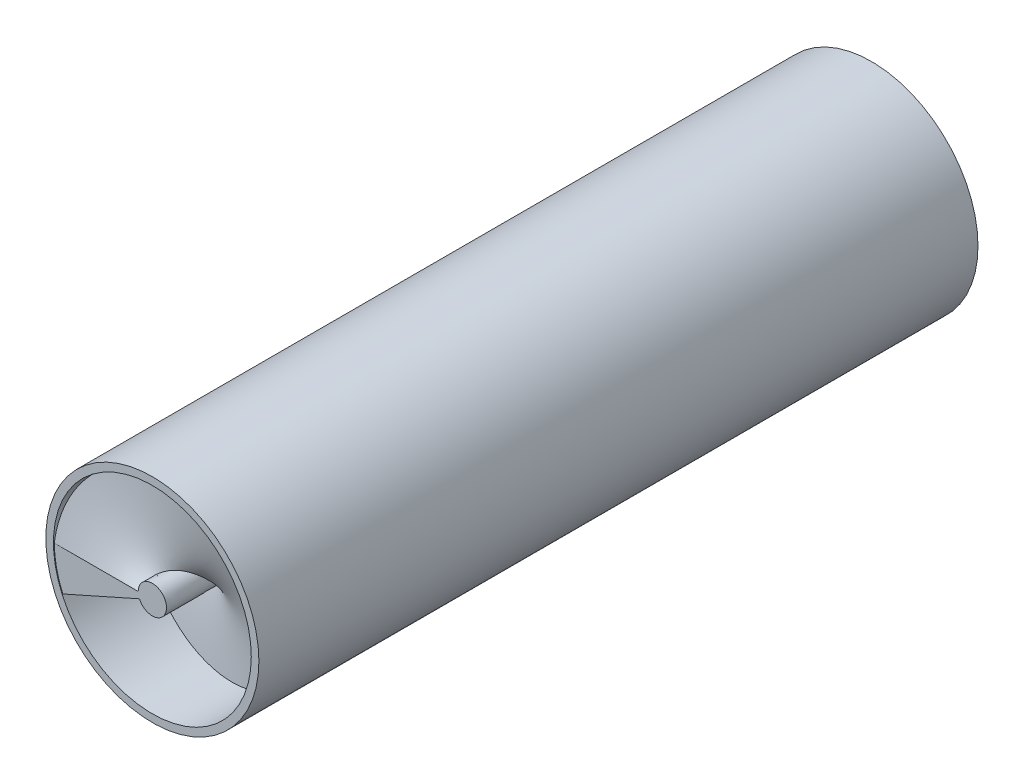
from build123d import *

# Parameters (mm, degrees)
SKETCH2_R           = 44.45
SKETCH2_R_2         = 41.275
BOSS_EXTRUDE2_DEPTH = 300
SKETCH3_R           = 40.9
BOSS_EXTRUDE3_DEPTH = 300
CUT_SWEEP2_PITCH    = 37.5


with BuildPart() as part:
    # Sketch2 → Boss-Extrude2 (new body)
    with BuildSketch(Plane.XY):
        Circle(SKETCH2_R)
        Circle(SKETCH2_R_2, mode=Mode.SUBTRACT)
    extrude(amount=BOSS_EXTRUDE2_DEPTH)


with BuildPart() as body_2:
    # Sketch3 → Boss-Extrude3 (new body)
    with BuildSketch(Plane.XY):
        Circle(SKETCH3_R)
    extrude(amount=BOSS_EXTRUDE3_DEPTH)

    # Cut-Sweep2: arcs per turn and ends read off the stored shape
    # Cut-Sweep2: the profile of Sketch8 profile screwed along a right-hand helix through 9.5 turns, 24 arcs to a turn; built about Z, then put on its axis
    cut_sweep2_z = Axis((0, 0, 0), (0, 0, 1))
    cut_sweep2_corners = [(40.9003, 0, -37.5), (5.9, 0, -37.5), (5.9, 0, -2.5), (40.9003, 0, -2.5)]
    with BuildLine(mode=Mode.PRIVATE) as cut_sweep2_profile:
        Line(cut_sweep2_corners[0], cut_sweep2_corners[1])
        Line(cut_sweep2_corners[1], cut_sweep2_corners[2])
        Line(cut_sweep2_corners[2], cut_sweep2_corners[3])
        Line(cut_sweep2_corners[3], cut_sweep2_corners[0])
    cut_sweep2_cap = Face(cut_sweep2_profile.wire())
    cut_sweep2_turn_angles = [0, 7.5, 15, 22.5, 30, 37.5, 45, 52.5, 60, 67.5, 75, 82.5, 90, 97.5, 105, 112.5, 120, 127.5, 135, 142.5, 150, 157.5, 165, 172.5, 180, 187.5, 195, 202.5, 210, 217.5, 225, 232.5, 240, 247.5, 255, 262.5, 270, 277.5, 285, 292.5, 300, 307.5, 315, 322.5, 330, 337.5, 345, 352.5, 360]
    cut_sweep2_turn_weights = [1, 0.9914448613738104, 1, 0.9914448613738104, 1, 0.9914448613738104, 1, 0.9914448613738104, 1, 0.9914448613738104, 1, 0.9914448613738104, 1, 0.9914448613738104, 1, 0.9914448613738104, 1, 0.9914448613738104, 1, 0.9914448613738104, 1, 0.9914448613738104, 1, 0.9914448613738104, 1, 0.9914448613738104, 1, 0.9914448613738104, 1, 0.9914448613738104, 1, 0.9914448613738104, 1, 0.9914448613738104, 1, 0.9914448613738104, 1, 0.9914448613738104, 1, 0.9914448613738104, 1, 0.9914448613738104, 1, 0.9914448613738104, 1, 0.9914448613738104, 1, 0.9914448613738104, 1]
    cut_sweep2_turn_rails = [Edge.make_bspline([Vector(p[0], p[1], 0).rotate(cut_sweep2_z, cut_sweep2_turn_angles[k]) / cut_sweep2_turn_weights[k] + Vector(0, 0, p[2] + CUT_SWEEP2_PITCH * cut_sweep2_turn_angles[k] / 360) for k in range(49)], [0, 0, 0, 1, 1, 2, 2, 3, 3, 4, 4, 5, 5, 6, 6, 7, 7, 8, 8, 9, 9, 10, 10, 11, 11, 12, 12, 13, 13, 14, 14, 15, 15, 16, 16, 17, 17, 18, 18, 19, 19, 20, 20, 21, 21, 22, 22, 23, 23, 24, 24, 24], 2, cut_sweep2_turn_weights) for p in cut_sweep2_corners]
    cut_sweep2_turn_sides = [Face.make_surface_from_curves(cut_sweep2_turn_rails[p[0]], cut_sweep2_turn_rails[p[1]]) for p in [(0, 1), (1, 2), (2, 3), (3, 0)]]
    cut_sweep2_last_angles = [3240, 3247.5, 3255, 3262.5, 3270, 3277.5, 3285, 3292.5, 3300, 3307.5, 3315, 3322.5, 3330, 3337.5, 3345, 3352.5, 3360, 3367.5, 3375, 3382.5, 3390, 3397.5, 3405, 3412.5, 3420]
    cut_sweep2_last_weights = [1, 0.9914448613738104, 1, 0.9914448613738104, 1, 0.9914448613738104, 1, 0.9914448613738104, 1, 0.9914448613738104, 1, 0.9914448613738104, 1, 0.9914448613738104, 1, 0.9914448613738104, 1, 0.9914448613738104, 1, 0.9914448613738104, 1, 0.9914448613738104, 1, 0.9914448613738104, 1]
    cut_sweep2_last_rails = [Edge.make_bspline([Vector(p[0], p[1], 0).rotate(cut_sweep2_z, cut_sweep2_last_angles[k]) / cut_sweep2_last_weights[k] + Vector(0, 0, p[2] + CUT_SWEEP2_PITCH * cut_sweep2_last_angles[k] / 360) for k in range(25)], [0, 0, 0, 1, 1, 2, 2, 3, 3, 4, 4, 5, 5, 6, 6, 7, 7, 8, 8, 9, 9, 10, 10, 11, 11, 12, 12, 12], 2, cut_sweep2_last_weights) for p in cut_sweep2_corners]
    cut_sweep2_last_sides = [Face.make_surface_from_curves(cut_sweep2_last_rails[p[0]], cut_sweep2_last_rails[p[1]]) for p in [(0, 1), (1, 2), (2, 3), (3, 0)]]
    cut_sweep2 = Plane(origin=(0, 0, 0), x_dir=(-1, 0, 0), z_dir=(0, 0, 1)) * Solid(Shell([*[p.moved(Location((0, 0, CUT_SWEEP2_PITCH * i))) for i in range(9) for p in cut_sweep2_turn_sides], *cut_sweep2_last_sides, cut_sweep2_cap, cut_sweep2_cap.rotate(cut_sweep2_z, 3420).moved(Location((0, 0, CUT_SWEEP2_PITCH * 3420 / 360)))]))
    add(cut_sweep2, mode=Mode.SUBTRACT)


solid = Compound([part.part, body_2.part])
